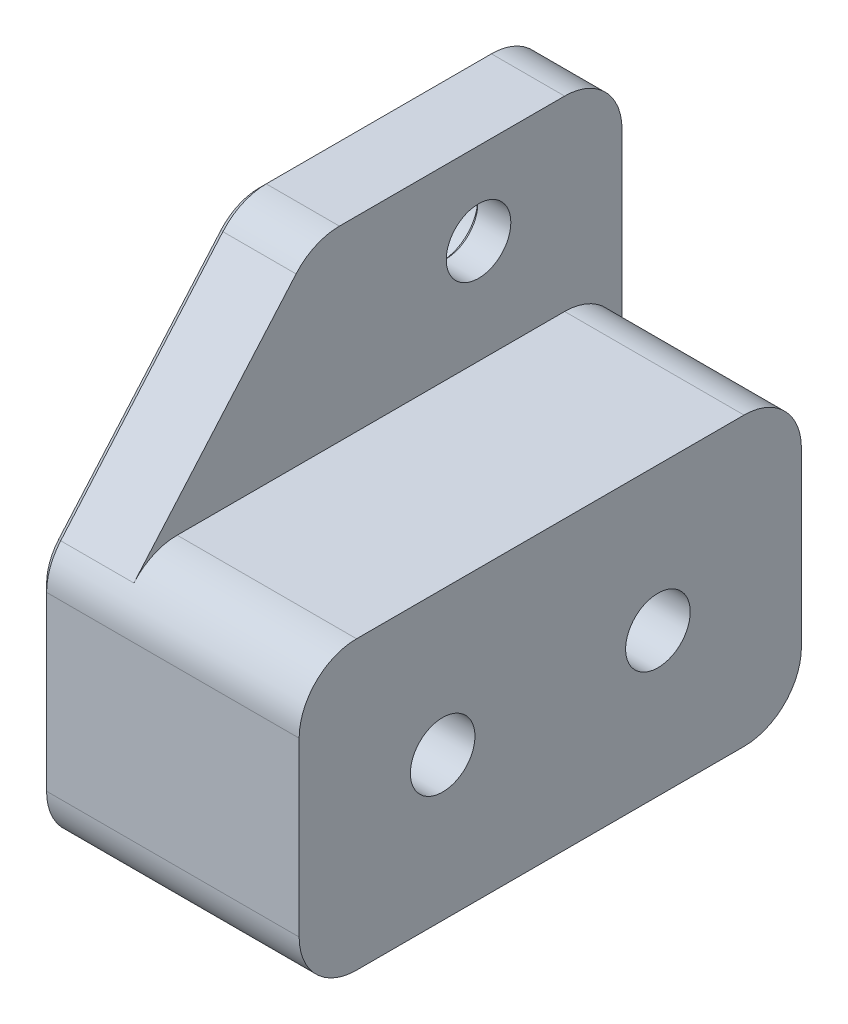
from build123d import *

# Parameters (mm, degrees)
SKETCH1_R           = 2.25
BOSS_EXTRUDE1_DEPTH = 2.6
BOSS_EXTRUDE3_START = -3
SKETCH3_R           = 3.75
BOSS_EXTRUDE3_DEPTH = 3
CHAMFER2_SIZE       = 0.3
CHAMFER3_SIZE       = 0.5
SKETCH4_R           = 2.25
BOSS_EXTRUDE4_DEPTH = 12.5


with BuildPart() as part:
    # Sketch1 → Boss-Extrude1 (new body)
    with BuildSketch(Plane(origin=(0, 0, 0), x_dir=(0, 0, -1), z_dir=(1, 0, 0))):
        with BuildLine():
            Line((-21, -10), (6, -10))
            ThreePointArc((6, -10), (8.828427125, -8.828427125), (10, -6))
            Line((10, -6), (10, 19))
            ThreePointArc((10, 19), (8.828427125, 21.828427125), (6, 23))
            Line((6, 23), (-9.695652174, 23))
            ThreePointArc((-9.695652174, 23), (-11.354136506, 22.63997661), (-12.714074263, 21.62471486))
            Line((-12.714074263, 21.62471486), (-24.018422089, 8.62471486))
            ThreePointArc((-24.018422089, 8.62471486), (-24.746577662, 7.401126626), (-25, 6))
            Line((-25, 6), (-25, -6))
            ThreePointArc((-25, -6), (-23.828427125, -8.828427125), (-21, -10))
        make_face()
        with Locations((-15, 0)):
            Circle(SKETCH1_R, mode=Mode.SUBTRACT)
        with Locations((0, 17.25)):
            Circle(SKETCH1_R, mode=Mode.SUBTRACT)
        Circle(SKETCH1_R, mode=Mode.SUBTRACT)
    extrude(amount=BOSS_EXTRUDE1_DEPTH)

    # Sketch3 → Boss-Extrude3 (add)
    with BuildSketch(Plane(origin=(0, 0, 0), x_dir=(0, 0, -1), z_dir=(1, 0, 0)).offset(BOSS_EXTRUDE3_START)):
        with BuildLine():
            Line((-21, -10), (6, -10))
            ThreePointArc((6, -10), (8.828427125, -8.828427125), (10, -6))
            Line((10, -6), (10, 19))
            ThreePointArc((10, 19), (8.828427125, 21.828427125), (6, 23))
            Line((6, 23), (-9.695652174, 23))
            ThreePointArc((-9.695652174, 23), (-11.354136506, 22.63997661), (-12.714074263, 21.62471486))
            Line((-12.714074263, 21.62471486), (-24.018422089, 8.62471486))
            ThreePointArc((-24.018422089, 8.62471486), (-24.746577662, 7.401126626), (-25, 6))
            Line((-25, 6), (-25, -6))
            ThreePointArc((-25, -6), (-23.828427125, -8.828427125), (-21, -10))
        make_face()
        with Locations((-15, 0)):
            Circle(SKETCH3_R, mode=Mode.SUBTRACT)
        Circle(SKETCH3_R, mode=Mode.SUBTRACT)
        with Locations((0, 17.25)):
            Circle(SKETCH3_R, mode=Mode.SUBTRACT)
    extrude(amount=BOSS_EXTRUDE3_DEPTH)

    # Chamfer2
    chamfer2_edges = [part.edges().sort_by_distance(p)[0] for p in [
        (0, 0, 18.75),
        (0, 0, 17.25),
        (0, 0, 3.75),
        (0, 0, 2.25),
        (0, 17.25, 2.25),
        (0, 17.25, 3.75),
    ]]
    chamfer(chamfer2_edges, length=CHAMFER2_SIZE)

    # Chamfer3
    chamfer3_edges = [part.edges().sort_by_distance(p)[0] for p in [
        (-3, 0, 3.75),
        (-3, 0, 25),
        (-3, 7.401126626, 24.746577662),
        (-3, 15.12471486, 18.366248176),
        (-3, 22.63997661, 11.354136506),
        (-3, 23, 1.847826087),
        (-3, 21.828427125, -8.828427125),
        (-3, 6.5, -10),
        (-3, -8.828427125, -8.828427125),
        (-3, -10, 7.5),
        (-3, -8.828427125, 23.828427125),
        (-3, 0, 18.75),
        (-3, 17.25, 3.75),
    ]]
    chamfer(chamfer3_edges, length=CHAMFER3_SIZE)

    # Sketch4 → Boss-Extrude4 (add)
    with BuildSketch(Plane(origin=(2.6, 0, 0), x_dir=(0, 0, -1), z_dir=(1, 0, 0))):
        with BuildLine():
            Line((-21, -10), (6, -10))
            ThreePointArc((6, -10), (8.828427125, -8.828427125), (10, -6))
            Line((10, -6), (10, 6))
            ThreePointArc((10, 6), (8.828427125, 8.828427125), (6, 10))
            Line((6, 10), (-21, 10))
            ThreePointArc((-21, 10), (-23.828427125, 8.828427125), (-25, 6))
            Line((-25, 6), (-25, -6))
            ThreePointArc((-25, -6), (-23.828427125, -8.828427125), (-21, -10))
        make_face()
        Circle(SKETCH4_R, mode=Mode.SUBTRACT)
        with Locations((-15, 0)):
            Circle(SKETCH4_R, mode=Mode.SUBTRACT)
    extrude(amount=BOSS_EXTRUDE4_DEPTH)


solid = part.part
